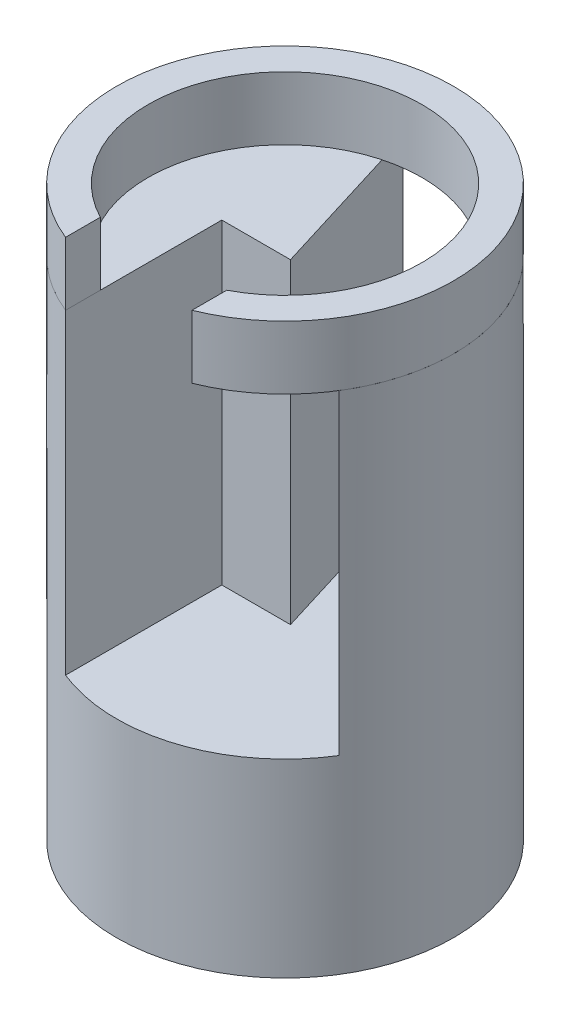
from build123d import *

# Parameters (mm, degrees)
SKETCH2_R           = 101.6
BOSS_EXTRUDE1_DEPTH = 304.8
SKETCH3_R           = 101.6
SKETCH3_R_2         = 82.55
BOSS_EXTRUDE2_DEPTH = 38.1
CUT_EXTRUDE1_START  = -228.6
CUT_EXTRUDE1_DEPTH  = 228.6
CUT_EXTRUDE2_START  = -228.6
CUT_EXTRUDE2_DEPTH  = 190.5


with BuildPart() as part:
    # Sketch2 → Boss-Extrude1 (new body)
    with BuildSketch(Plane(origin=(0, 0, 0), x_dir=(1, 0, 0), z_dir=(0, 1, 0))):
        Circle(SKETCH2_R)
    extrude(amount=BOSS_EXTRUDE1_DEPTH)


with BuildPart() as body_2:
    # Sketch3 → Boss-Extrude2 (new body)
    with BuildSketch(Plane(origin=(0, 304.8, 0), x_dir=(1, 0, 0), z_dir=(0, 1, 0))):
        Circle(SKETCH3_R)
        Circle(SKETCH3_R_2, mode=Mode.SUBTRACT)
    extrude(amount=BOSS_EXTRUDE2_DEPTH)


with BuildPart() as cut_extrude1_tool:
    # Sketch4 → Cut-Extrude1 (new body)
    with BuildSketch(Plane(origin=(0, 342.9, 0), x_dir=(1, 0, 0), z_dir=(0, 1, 0)).offset(CUT_EXTRUDE1_START)):
        with BuildLine():
            Line((-38.1, 0), (-38.1, -94.185720786))
            ThreePointArc((-38.1, -94.185720786), (0, -101.6), (38.1, -94.185720786))
            Line((38.1, -94.185720786), (38.1, 0))
            Line((38.1, 0), (-38.1, 0))
        make_face()
    extrude(amount=CUT_EXTRUDE1_DEPTH)


with BuildPart() as part_1:
    add(part.part)

    # Cut-Extrude1: cut by cut_extrude1_tool
    add(cut_extrude1_tool.part, mode=Mode.SUBTRACT)

    # Sketch4<4> → Cut-Extrude2 (cut)
    with BuildSketch(Plane(origin=(0, 342.9, 0), x_dir=(1, 0, 0), z_dir=(0, 1, 0)).offset(CUT_EXTRUDE2_START)):
        with BuildLine():
            Line((3.286721048, 0), (38.1, 0))
            Line((38.1, 0), (38.1, -94.185720786))
            ThreePointArc((38.1, -94.185720786), (65.394822961, -77.756524678), (86.259952515, -53.682218584))
            Line((86.259952515, -53.682218584), (41.119749671, 92.907083621))
            ThreePointArc((41.119749671, 92.907083621), (7.555847472, 101.318651634), (-26.884440108, 97.978502132))
            Line((-26.884440108, 97.978502132), (3.286721048, 0))
        make_face()
    extrude(amount=CUT_EXTRUDE2_DEPTH, mode=Mode.SUBTRACT)


with BuildPart() as body_2_1:
    add(body_2.part)

    # Cut-Extrude1: cut by cut_extrude1_tool
    add(cut_extrude1_tool.part, mode=Mode.SUBTRACT)


solid = Compound([part_1.part, body_2_1.part])
